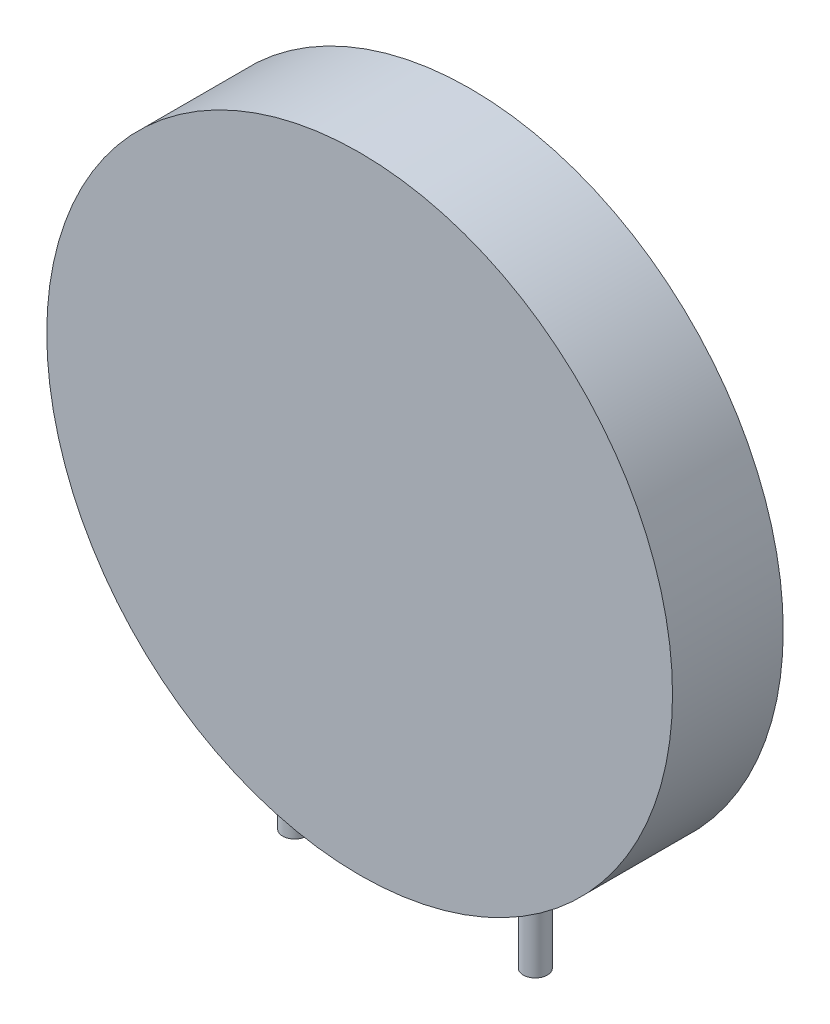
from build123d import *

# Parameters (mm, degrees)
SKETCH1_R           = 13
BOSS_EXTRUDE1_DEPTH = 2.3
SKETCH2_R           = 0.5
BOSS_EXTRUDE2_DEPTH = 15


with BuildPart() as part:
    # Sketch1 → Boss-Extrude1 (new, symmetric)
    with BuildSketch(Plane.XY):
        Circle(SKETCH1_R)
    extrude(amount=BOSS_EXTRUDE1_DEPTH, both=True)

    # Sketch2 → Boss-Extrude2 (add)
    with BuildSketch(Plane(origin=(0, 0, 0), x_dir=(1, 0, 0), z_dir=(0, 1, 0))):
        with Locations((-5, 0)):
            Circle(SKETCH2_R)
        with Locations((5, 0)):
            Circle(SKETCH2_R)
    extrude(amount=-BOSS_EXTRUDE2_DEPTH)


solid = part.part
